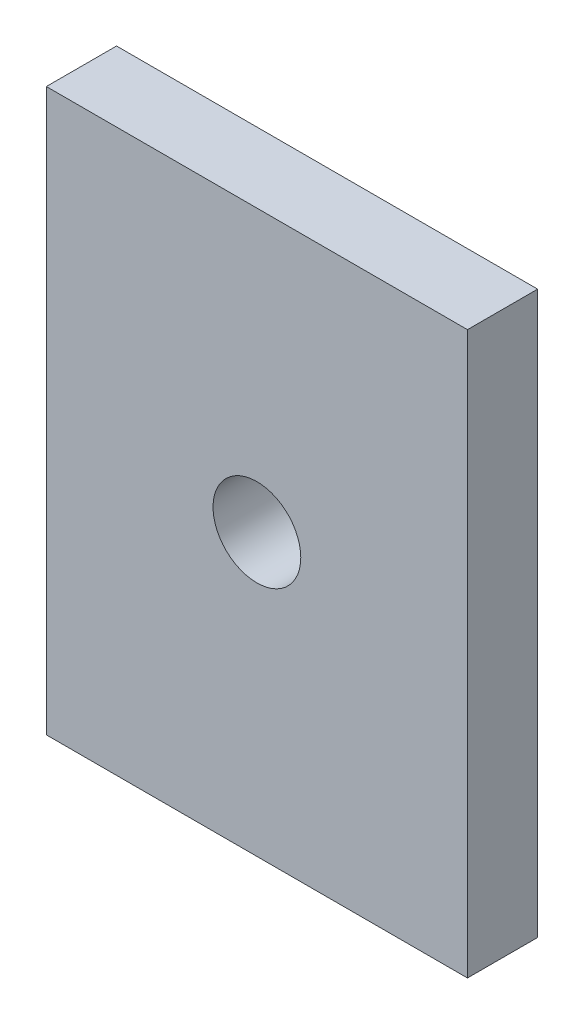
from build123d import *

# Parameters (mm, degrees)
SKETCH1_W           = 76.2
SKETCH1_H           = 101.6
SKETCH1_R           = 7.9375
BOSS_EXTRUDE1_DEPTH = 12.7


with BuildPart() as part:
    # Sketch1 → Boss-Extrude1 (new body)
    with BuildSketch(Plane.XY):
        Rectangle(SKETCH1_W, SKETCH1_H)
        Circle(SKETCH1_R, mode=Mode.SUBTRACT)
    extrude(amount=BOSS_EXTRUDE1_DEPTH)


solid = part.part
